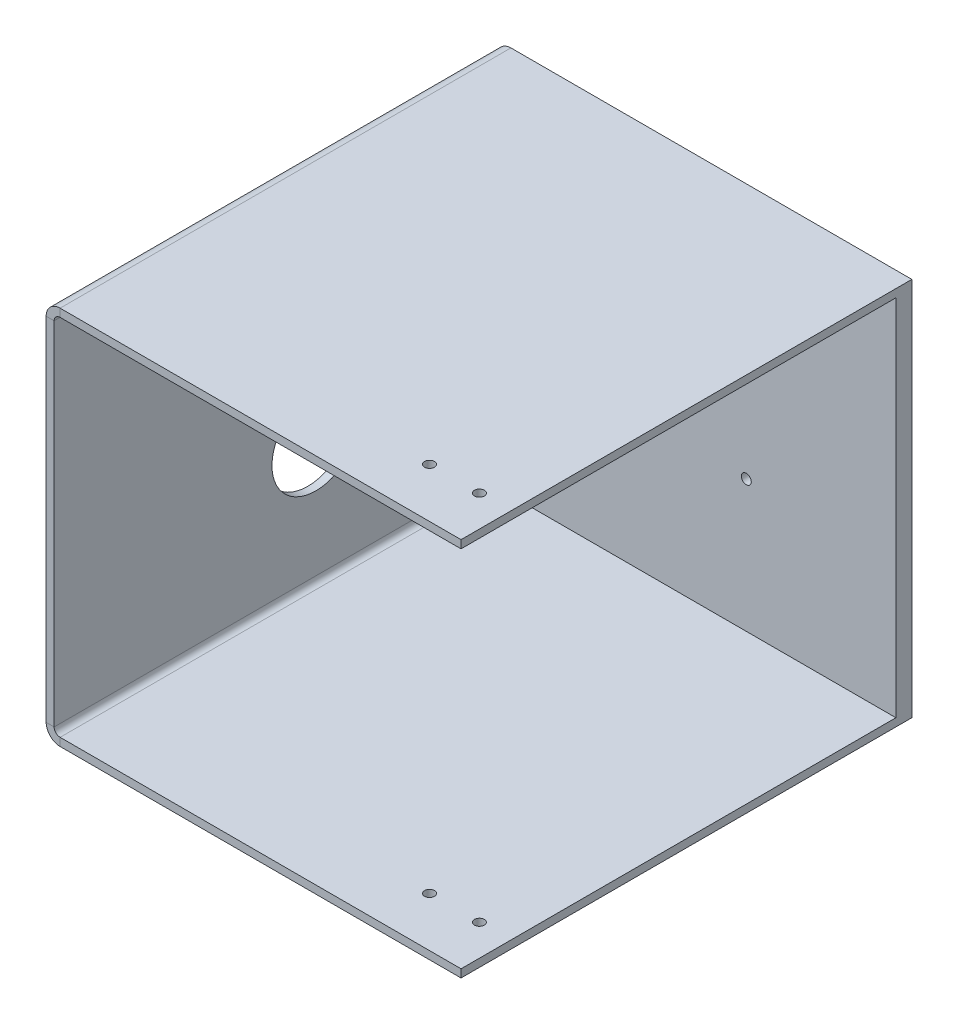
from build123d import *

# Parameters (mm, degrees)
SM_BASE_FLANGE_1_DEPTH = 113
EXTRUDE_1_DEPTH        = 4
HOLE_WIZARD_M3_1_D     = 2.5
SKETCH_10_R            = 11
CUT_EXTRUDE_1_DEPTH    = 2
HOLE_WIZARD_M3_2_D     = 2.5


# Sheet-metal steps are written as plain solids
with BuildPart() as part:
    # Sketch 1 → 基体-法兰1 (new body)
    with BuildSketch(Plane.XY):
        with BuildLine():
            Line((104, 47.58), (3.5, 47.58))
            ThreePointArc((3.5, 47.58), (1.025126266, 46.554873734), (0, 44.08))
            Line((0, 44.08), (0, -44.08))
            ThreePointArc((0, -44.08), (1.025126266, -46.554873734), (3.5, -47.58))
            Line((3.5, -47.58), (104, -47.58))
            Line((104, -47.58), (104, -45.58))
            Line((104, -45.58), (3.5, -45.58))
            ThreePointArc((3.5, -45.58), (2.439339828, -45.140660172), (2, -44.08))
            Line((2, -44.08), (2, 44.08))
            ThreePointArc((2, 44.08), (2.439339828, 45.140660172), (3.5, 45.58))
            Line((3.5, 45.58), (104, 45.58))
            Line((104, 45.58), (104, 47.58))
        make_face()
    extrude(amount=SM_BASE_FLANGE_1_DEPTH)

    # 草图6 → 凸台-拉伸1 (add)
    with BuildSketch(Plane.XY):
        with BuildLine():
            Line((104, 45.58), (3.5, 45.58))
            ThreePointArc((3.5, 45.58), (2.439339828, 45.140660172), (2, 44.08))
            Line((2, 44.08), (2, -44.08))
            ThreePointArc((2, -44.08), (2.439339828, -45.140660172), (3.5, -45.58))
            Line((3.5, -45.58), (104, -45.58))
            Line((104, -45.58), (104, 45.58))
        make_face()
    extrude(amount=EXTRUDE_1_DEPTH)

    # M3 螺纹孔1 (through all)
    with Locations(Plane(origin=(0, -47.58, 0), x_dir=(-1, 0, 0), z_dir=(0, -1, 0))):
        with Locations((-83.7, -100.6), (-96.2, -100.6)):
            Hole(HOLE_WIZARD_M3_1_D / 2)

    # 草图10 → 切除-拉伸1 (cut)
    with BuildSketch(Plane.ZY):
        with Locations(Location((47.4, -14.64, 0), (0, 0, 270))):
            Circle(SKETCH_10_R)
    extrude(amount=-CUT_EXTRUDE_1_DEPTH, mode=Mode.SUBTRACT)

    # M3 螺纹孔2 (through all)
    with Locations(Plane.XY.offset(4)):
        with Locations((41.5, 12.5), (66.5, 12.5), (66.5, -12.5), (41.5, -12.5)):
            Hole(HOLE_WIZARD_M3_2_D / 2)


solid = part.part
